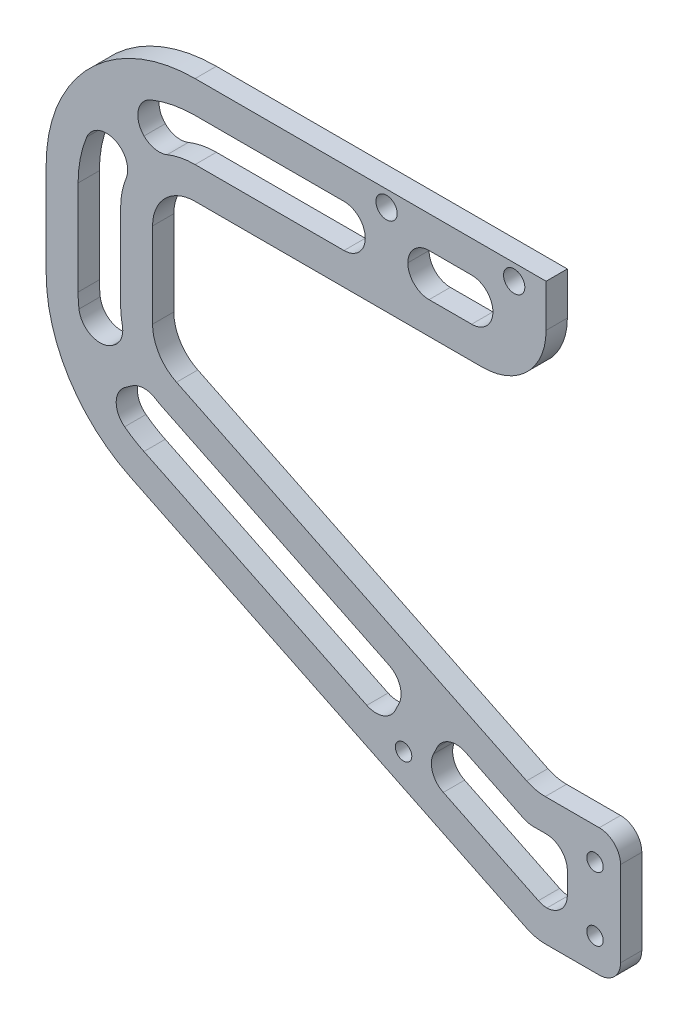
from build123d import *

# Parameters (mm, degrees)
BOSS_EXTRUDE1_DEPTH              = 6.35
F_1_4_0_25_DIAMETER_HOLE1_D      = 6.35
F_1_4_0_25_DIAMETER_HOLE1_DEPTH  = 9.652
F_1_4_0_25_DIAMETER_HOLE1_TIP    = 1.9077324654125039
F_10_0_1935_DIAMETER_HOLE1_D     = 4.9149
F_10_0_1935_DIAMETER_HOLE1_DEPTH = 9.652
F_10_0_1935_DIAMETER_HOLE1_TIP   = 1.476584928229278
FILLET1_R                        = 12.7
FILLET2_R                        = 6.35
SKETCH8_W                        = 25.40000000000005
SKETCH8_H                        = 12.699999999999989
CUT_EXTRUDE3_DEPTH               = 243.55005153576033
FILLET4_R                        = 6.35
FILLET5_R                        = 19.05


with BuildPart() as part:
    # Sketch1 → Boss-Extrude1 (new body)
    with BuildSketch(Plane.XY):
        with BuildLine():
            Line((0, 0), (0, 38.1))
            Line((0, 38.1), (-25.400000000000002, 38.1))
            Line((-25.400000000000002, 38.1), (-132.55149215165815, 90.17761255734695))
            ThreePointArc((-132.55149215165815, 90.17761255734695), (-137.76554574385477, 94.862565411303), (-139.70000000000002, 101.6))
            Line((-139.70000000000002, 101.6), (-139.70000000000002, 127))
            ThreePointArc((-139.70000000000002, 127), (-135.98025612106917, 135.98025612106917), (-127, 139.69999999999996))
            Line((-127, 139.69999999999996), (-22.22499999999998, 139.7))
            Line((-22.22499999999998, 139.7), (-22.224999999999984, 171.45))
            Line((-22.224999999999984, 171.45), (-127, 171.45))
            ThreePointArc((-127, 171.45), (-158.430896423742, 158.43089642374204), (-171.45, 127))
            Line((-171.45, 127), (-171.45, 98.80128898397304))
            ThreePointArc((-171.45, 98.80128898397304), (-164.67941010349165, 75.22026792353354), (-146.43022253080355, 58.82293293468738))
            Line((-146.43022253080355, 58.82293293468738), (-25.4, -3.11e-15))
            Line((-25.4, -3.11e-15), (0, 0))
        make_face()
    extrude(amount=BOSS_EXTRUDE1_DEPTH)

    # 1/4 (0.25) Diameter Hole1
    with Locations(Plane.XY.offset(6.35)):
        with Locations((-69.85, 166.6875), (-31.75, 166.6875)):
            Hole(F_1_4_0_25_DIAMETER_HOLE1_D / 2, depth=F_1_4_0_25_DIAMETER_HOLE1_DEPTH)
            with Locations((0, 0, -(F_1_4_0_25_DIAMETER_HOLE1_DEPTH + F_1_4_0_25_DIAMETER_HOLE1_TIP / 2))):  # 118° drill point
                Cone(0, F_1_4_0_25_DIAMETER_HOLE1_D / 2, F_1_4_0_25_DIAMETER_HOLE1_TIP, mode=Mode.SUBTRACT)

    # #10 (0.1935) Diameter Hole1
    with Locations(Plane.XY.offset(6.35)):
        with Locations((-7.62, 28.575), (-7.62, 9.525), (-64.77, 28.575)):
            Hole(F_10_0_1935_DIAMETER_HOLE1_D / 2, depth=F_10_0_1935_DIAMETER_HOLE1_DEPTH)
            with Locations((0, 0, -(F_10_0_1935_DIAMETER_HOLE1_DEPTH + F_10_0_1935_DIAMETER_HOLE1_TIP / 2))):  # 118° drill point
                Cone(0, F_10_0_1935_DIAMETER_HOLE1_D / 2, F_10_0_1935_DIAMETER_HOLE1_TIP, mode=Mode.SUBTRACT)

    # Fillet1
    fillet1_edges = [part.edges().sort_by_distance(p)[0] for p in [
        (-25.4, -3.11e-15, 3.175),
        (-25.400000000000002, 38.1, 3.175),
    ]]
    fillet(fillet1_edges, radius=FILLET1_R)

    # Fillet2
    fillet2_edges = [part.edges().sort_by_distance(p)[0] for p in [
        (0, 38.1, 3.175),
        (0, 0, 3.175),
    ]]
    fillet(fillet2_edges, radius=FILLET2_R)

    # Sketch8 → Cut-Extrude3 (cut, through all)
    with BuildSketch(Plane.XY.offset(6.35)):
        with BuildLine():
            Line((-76.19999999999997, 161.92499999999998), (-127, 161.92499999999998))
            ThreePointArc((-127, 161.92499999999998), (-138.12882691189947, 160.1044534249545), (-148.09742202888222, 154.83261411968402))
            Line((-148.09742202888222, 154.83261411968402), (-138.98279839171374, 145.71799048251555))
            ThreePointArc((-138.98279839171374, 145.71799048251555), (-133.24272722958852, 148.33023632632685), (-127, 149.225))
            Line((-127, 149.225), (-76.19999999999997, 149.225))
            Line((-76.19999999999997, 149.225), (-76.19999999999997, 161.92499999999998))
        make_face()
        with BuildLine():
            Line((-161.925, 127), (-161.925, 98.80128898397304))
            ThreePointArc((-161.925, 98.80128898397304), (-161.20295128798153, 91.73632272842997), (-159.06666080504155, 84.96348244484211))
            Line((-159.06666080504155, 84.96348244484211), (-147.51497280949854, 93.050934809844))
            ThreePointArc((-147.51497280949854, 93.050934809844), (-148.79330052666535, 97.24079397659989), (-149.225, 101.6))
            Line((-149.225, 101.6), (-149.225, 127))
            ThreePointArc((-149.225, 127), (-148.33023632632688, 133.2427272295885), (-145.71799048251557, 138.98279839171371))
            Line((-145.71799048251557, 138.98279839171371), (-154.83261411968402, 148.09742202888222))
            ThreePointArc((-154.83261411968402, 148.09742202888222), (-160.1044534249545, 138.12882691189947), (-161.925, 127))
        make_face()
        with BuildLine():
            Line((-142.05216791273205, 85.24815404527915), (-154.12206516409194, 76.79789819448892))
            ThreePointArc((-154.12206516409194, 76.79789819448892), (-148.7100954330638, 71.44388813361326), (-142.2666034170599, 67.38972351667718))
            Line((-142.2666034170599, 67.38972351667718), (-70.02909509590478, 32.28095466133805))
            Line((-70.02909509590478, 32.28095466133805), (-63.37728743967065, 45.967279376904486))
            Line((-63.37728743967065, 45.967279376904486), (-136.7151112654018, 81.61082197535714))
            ThreePointArc((-136.7151112654018, 81.61082197535714), (-139.51647217144776, 83.23458278771281), (-142.05216791273205, 85.24815404527915))
        make_face()
        Polygon((-51.95489999701758, 40.415787225246326), (-27.59207003743942, 28.574999999999996), (-15.875, 28.574999999999996), (-15.874999999999996, 9.525000000000002), (-23.20792996256074, 9.524999999999999), (-58.6067076532517, 26.729462509679877), align=None)
        with Locations((-50.79999999999999, 155.575)):
            Rectangle(SKETCH8_W, SKETCH8_H)
    extrude(amount=-CUT_EXTRUDE3_DEPTH, mode=Mode.SUBTRACT)

    # Fillet4
    # the kernel refuses this fillet: 6.35 mm, written as the material it adds along each edge
    with BuildSketch(Plane(origin=(-23.20792996256074, 9.524999999999999, 6.35), x_dir=(-0.899400586035673, 0.43712536627229515, 0), z_dir=(0, 0, -1))) as fillet4_piece_1:
        with BuildLine():
            CenterArc((FILLET4_R * 0.230138586608, FILLET4_R), FILLET4_R, 244.0793884634155, 25.920611536584488)
            Line((-FILLET4_R * 0.206986779664, FILLET4_R * 0.100599413964), (0, 0))
            Line((0, 0), (FILLET4_R * 0.230138586608, 1e-17))
        make_face()
    extrude(amount=6.35)
    with BuildSketch(Plane(origin=(-15.874999999999996, 9.525000000000002, 6.35), x_dir=(-1, -5.6e-16, 0), z_dir=(0, 0, -1))) as fillet4_piece_2:
        with BuildLine():
            CenterArc((FILLET4_R, FILLET4_R), FILLET4_R, 180, 90)
            Line((-1.78e-15, FILLET4_R), (0, 0))
            Line((0, 0), (FILLET4_R, 0))
        make_face()
    extrude(amount=6.35)
    with BuildSketch(Plane(origin=(-15.875, 28.574999999999996, 6.35), x_dir=(2.8e-16, -1, 0), z_dir=(0, 0, -1))) as fillet4_piece_3:
        with BuildLine():
            CenterArc((FILLET4_R, FILLET4_R), FILLET4_R, 180, 90)
            Line((-1.78e-15, FILLET4_R), (0, 0))
            Line((0, 0), (FILLET4_R, 0))
        make_face()
    extrude(amount=6.35)
    with BuildSketch(Plane(origin=(-58.6067076532517, 26.729462509679877, 6.35), x_dir=(0.43712536627229537, 0.8994005860356729, 0), z_dir=(0, 0, -1))) as fillet4_piece_4:
        with BuildLine():
            CenterArc((FILLET4_R, FILLET4_R), FILLET4_R, 180.00000000000009, 89.99999999999989)
            Line((3.06e-15, FILLET4_R), (0, 0))
            Line((0, 0), (FILLET4_R, -1.1e-16))
        make_face()
    extrude(amount=6.35)
    with BuildSketch(Plane(origin=(-51.95489999701758, 40.415787225246326, 6.35), x_dir=(-0.43712536627229487, -0.899400586035673, 0), z_dir=(0, 0, -1))) as fillet4_piece_5:
        with BuildLine():
            CenterArc((FILLET4_R, -FILLET4_R), FILLET4_R, 90, 90.00000000000011)
            Line((6.47e-15, -FILLET4_R), (0, 0))
            Line((0, 0), (FILLET4_R, 9e-17))
        make_face()
    extrude(amount=6.35)
    with BuildSketch(Plane(origin=(-63.37728743967065, 45.967279376904486, 6.35), x_dir=(-0.43712536627229537, -0.8994005860356729, 0), z_dir=(0, 0, -1))) as fillet4_piece_6:
        with BuildLine():
            CenterArc((FILLET4_R, FILLET4_R), FILLET4_R, 179.9999999999999, 90.00000000000011)
            Line((6e-15, FILLET4_R), (0, 0))
            Line((0, 0), (FILLET4_R, -1.1e-16))
        make_face()
    extrude(amount=6.35)
    with BuildSketch(Plane(origin=(-70.02909509590478, 32.28095466133805, 6.35), x_dir=(-0.8994005860356724, 0.4371253662722963, 0), z_dir=(0, 0, -1))) as fillet4_piece_7:
        with BuildLine():
            CenterArc((FILLET4_R, FILLET4_R), FILLET4_R, 179.99999999999994, 90)
            Line((6.38e-15, FILLET4_R), (0, 0))
            Line((0, 0), (FILLET4_R, 5e-17))
        make_face()
    extrude(amount=6.35)
    with BuildSketch(Plane(origin=(-154.12206516409194, 76.79789819448892, 6.35), x_dir=(0.819189581581614, 0.57352282380751, 0), z_dir=(0, 0, -1))) as fillet4_piece_8:
        with BuildLine():
            CenterArc((7.657764037607667, 6.350000000000007), FILLET4_R, 162.02178891468273, 107.97821108531724)
            ThreePointArc((1.6178093721145603, 8.3099611319585), (0.5561766270605806, 4.204182459459689), (0, 0))
            Line((0, 0), (7.657764037607664, -3.7e-16))
        make_face()
    extrude(amount=6.35)
    with BuildSketch(Plane(origin=(-142.05216791273205, 85.24815404527915, 6.35), x_dir=(-0.819189581581615, -0.5735228238075083, 0), z_dir=(0, 0, -1))) as fillet4_piece_9:
        with BuildLine():
            CenterArc((4.61697327270199, -6.350000000000006), FILLET4_R, 89.99999999999986, 67.11461952384218)
            ThreePointArc((-1.2331843436193552, -3.880555555555626), (-0.5275365740025959, -1.9685783567426014), (0, 0))
            Line((0, 0), (4.616973272702006, 1e-17))
        make_face()
    extrude(amount=6.35)
    with BuildSketch(Plane(origin=(-147.51497280949854, 93.050934809844, 6.35), x_dir=(-0.8191895815816139, -0.57352282380751, 0), z_dir=(0, 0, -1))) as fillet4_piece_10:
        with BuildLine():
            CenterArc((4.616973272701946, 6.350000000000006), FILLET4_R, 202.885380476159, 67.11461952384093)
            ThreePointArc((-1.2331843436193741, 3.880555555555511), (-0.5275365740026128, 1.9685783567425768), (0, 0))
            Line((0, 0), (4.616973272701943, 4e-17))
        make_face()
    extrude(amount=6.35)
    with BuildSketch(Plane(origin=(-159.06666080504155, 84.96348244484211, 6.35), x_dir=(-0.261857934927054, 0.9651064303566413, 0), z_dir=(0, 0, -1))) as fillet4_piece_11:
        with BuildLine():
            CenterArc((9.014629990057857, 6.285687270412339), FILLET4_R, 160.18408388914497, 117.9773499711298)
            Line((3.0406348569099713, 8.438332654381856), (0, 0))
            ThreePointArc((0, 0), (4.958046494531804, -0.35372001273222614), (9.916092989063605, -6e-17))
        make_face()
    extrude(amount=6.35)
    with BuildSketch(Plane(origin=(-154.83261411968402, 148.09742202888222, 6.35), x_dir=(0.7071067811865458, -0.7071067811865492, 0), z_dir=(0, 0, -1))) as fillet4_piece_12:
        with BuildLine():
            CenterArc((8.273051090908108, 6.350000000000015), FILLET4_R, 157.11461952384028, 112.88538047615978)
            ThreePointArc((2.4228934745868353, 8.819444444444574), (0.9214926410236765, 4.489378927608573), (0, 0))
            Line((0, 0), (8.273051090908114, -9e-17))
        make_face()
    extrude(amount=6.35)
    with BuildSketch(Plane(origin=(-145.71799048251557, 138.98279839171371, 6.35), x_dir=(-0.45974256906919553, -0.8880522339286445, 0), z_dir=(0, 0, -1))) as fillet4_piece_13:
        with BuildLine():
            CenterArc((4.653471653105217, 6.323301651399347), FILLET4_R, 197.6295027961731, 67.11461952384201)
            Line((-1.3982996116780777, 4.400136406615789), (0, 0))
            ThreePointArc((0, 0), (2.0358938482335205, 0.09344422010227843), (4.071787696467069, -1.1e-16))
        make_face()
    extrude(amount=6.35)
    with BuildSketch(Plane(origin=(-138.98279839171374, 145.71799048251555, 6.35), x_dir=(-0.7071067811865475, 0.7071067811865475, 0), z_dir=(0, 0, -1))) as fillet4_piece_14:
        with BuildLine():
            CenterArc((4.616973272701996, 6.349999999999994), FILLET4_R, 202.88538047615842, 67.11461952384161)
            ThreePointArc((-1.2331843436193233, 3.88055555555557), (-0.5275365740025925, 1.9685783567425814), (0, 0))
            Line((0, 0), (4.616973272701996, 6e-17))
        make_face()
    extrude(amount=6.35)
    with BuildSketch(Plane(origin=(-148.09742202888222, 154.83261411968402, 6.35), x_dir=(0.869162224980119, 0.4945270737458255, 0), z_dir=(0, 0, -1))) as fillet4_piece_15:
        with BuildLine():
            CenterArc((8.314729193934072, 6.29532785360028), FILLET4_R, 164.63856988037904, 112.88538047615813)
            Line((2.1915896078739827, 7.977487658619955), (0, 0))
            ThreePointArc((0, 0), (4.573101056663757, -0.30069680519851316), (9.14620211332749, -1.3e-16))
        make_face()
    extrude(amount=6.35)
    with BuildSketch(Plane(origin=(-76.19999999999997, 149.225, 6.35), x_dir=(-1, 0, 0), z_dir=(0, 0, -1))) as fillet4_piece_16:
        with BuildLine():
            CenterArc((FILLET4_R, FILLET4_R), FILLET4_R, 180, 90)
            Line((0, FILLET4_R), (0, 0))
            Line((0, 0), (FILLET4_R, 0))
        make_face()
    extrude(amount=6.35)
    with BuildSketch(Plane(origin=(-76.19999999999997, 161.92499999999998, 6.35), x_dir=(-1, 0, 0), z_dir=(0, 0, -1))) as fillet4_piece_17:
        with BuildLine():
            CenterArc((FILLET4_R, -FILLET4_R), FILLET4_R, 90, 90)
            Line((0, -FILLET4_R), (0, 0))
            Line((0, 0), (FILLET4_R, 0))
        make_face()
    extrude(amount=6.35)
    with BuildSketch(Plane(origin=(-38.099999999999966, 149.225, 6.35), x_dir=(-1, 0, 0), z_dir=(0, 0, -1))) as fillet4_piece_18:
        with BuildLine():
            CenterArc((FILLET4_R, FILLET4_R), FILLET4_R, 180, 90)
            Line((0, FILLET4_R), (0, 0))
            Line((0, 0), (FILLET4_R, 0))
        make_face()
    extrude(amount=6.35)
    with BuildSketch(Plane(origin=(-38.099999999999966, 161.92499999999998, 6.35), x_dir=(0, -1, 0), z_dir=(0, 0, -1)), Plane(origin=(-63.500000000000014, 149.225, 6.35), x_dir=(0, 1, 0), z_dir=(0, 0, -1))) as fillet4_piece_19:
        with BuildLine():
            CenterArc((FILLET4_R, FILLET4_R), FILLET4_R, 180, 90)
            Line((0, FILLET4_R), (0, 0))
            Line((0, 0), (FILLET4_R, 0))
        make_face()
    extrude(amount=6.35)
    with BuildSketch(Plane(origin=(-63.500000000000014, 161.92499999999998, 6.35), x_dir=(0, -1, 0), z_dir=(0, 0, -1))) as fillet4_piece_20:
        with BuildLine():
            CenterArc((FILLET4_R, -FILLET4_R), FILLET4_R, 90, 90)
            Line((0, -FILLET4_R), (0, 0))
            Line((0, 0), (FILLET4_R, 0))
        make_face()
    extrude(amount=6.35)
    # the kernel refuses this fillet: 6.35 mm, written as the material it takes off along each edge
    with BuildSketch(Plane(origin=(-27.592070037439417, 28.574999999999996, 10.003450062398983), x_dir=(1, 0, 0), z_dir=(0, 0, -1))) as fillet4_2_piece_1:
        with BuildLine():
            CenterArc((FILLET4_R * 0.230138586608, -FILLET4_R), FILLET4_R, 90, 25.920611536584403)
            Line((-FILLET4_R * 0.206986779664, -FILLET4_R * 0.100599413964), (0, 0))
            Line((0, 0), (FILLET4_R * 0.230138586608, 0))
        make_face()
    extrude(amount=13.656900124797966, mode=Mode.SUBTRACT)

    # Fillet5
    fillet5_edges = [part.edges().sort_by_distance(p)[0] for p in [
        (-22.22499999999998, 139.7, 3.175),
    ]]
    fillet(fillet5_edges, radius=FILLET5_R)


solid = part.part
